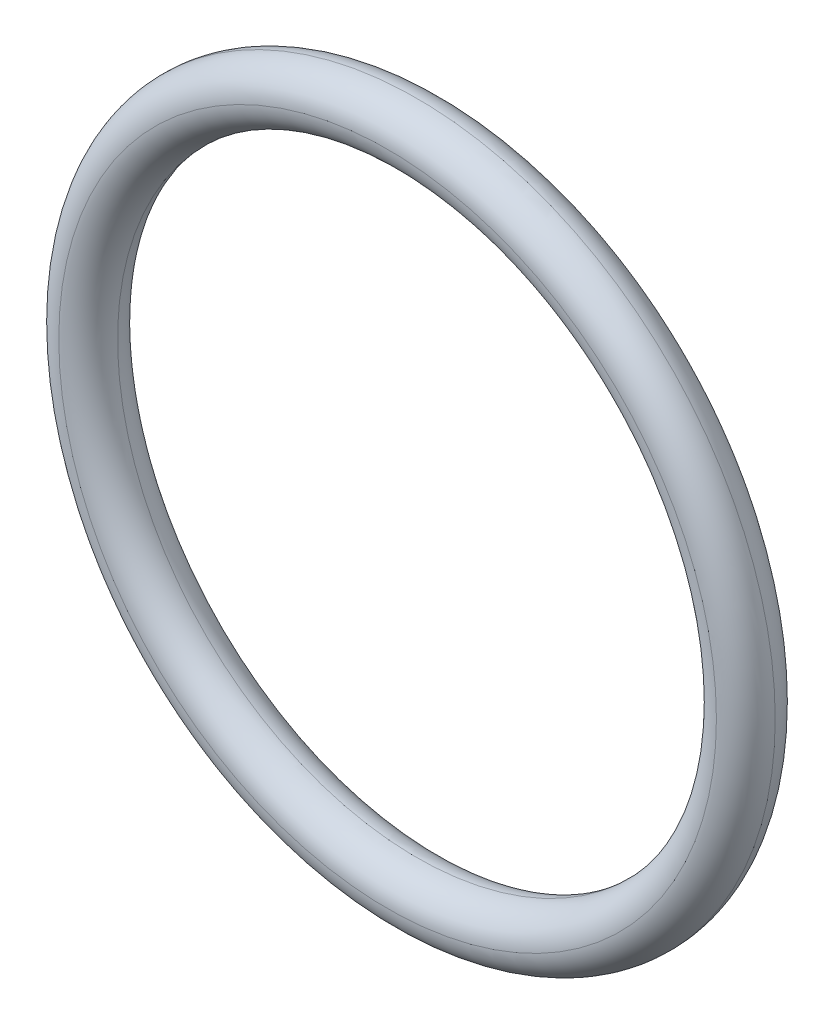
from build123d import *

# Parameters (mm, degrees)
ESQUISSE1_R             = 37.1475
BOSS_EXTRU_1_DEPTH      = 6.096
ESQUISSE2_R             = 31.0515
ENL_V_MAT_EXTRU_1_DEPTH = 53.886999617
CONG_6_R                = 3.048


with BuildPart() as part:
    # Esquisse1 → Boss.-Extru.1 (new body)
    with BuildSketch(Plane.XY):
        with Locations(Location((0, 0, 0), (0, 0, 180))):
            Circle(ESQUISSE1_R)
    extrude(amount=BOSS_EXTRU_1_DEPTH)

    # Esquisse2 → Enlèv. mat.-Extru.1 (cut, through all)
    with BuildSketch(Plane.XY.offset(6.096)):
        Circle(ESQUISSE2_R)
    extrude(amount=-ENL_V_MAT_EXTRU_1_DEPTH, mode=Mode.SUBTRACT)

    # Congé6
    cong_6_edges = [part.edges().sort_by_distance(p)[0] for p in [
        (37.1475, 0, 0),
        (37.1475, 0, 6.096),
        (-31.0515, 0, 0),
        (-31.0515, 0, 6.096),
    ]]
    fillet(cong_6_edges, radius=CONG_6_R - 0.0001)  # a hair under: the kernel refuses the full size


solid = part.part
